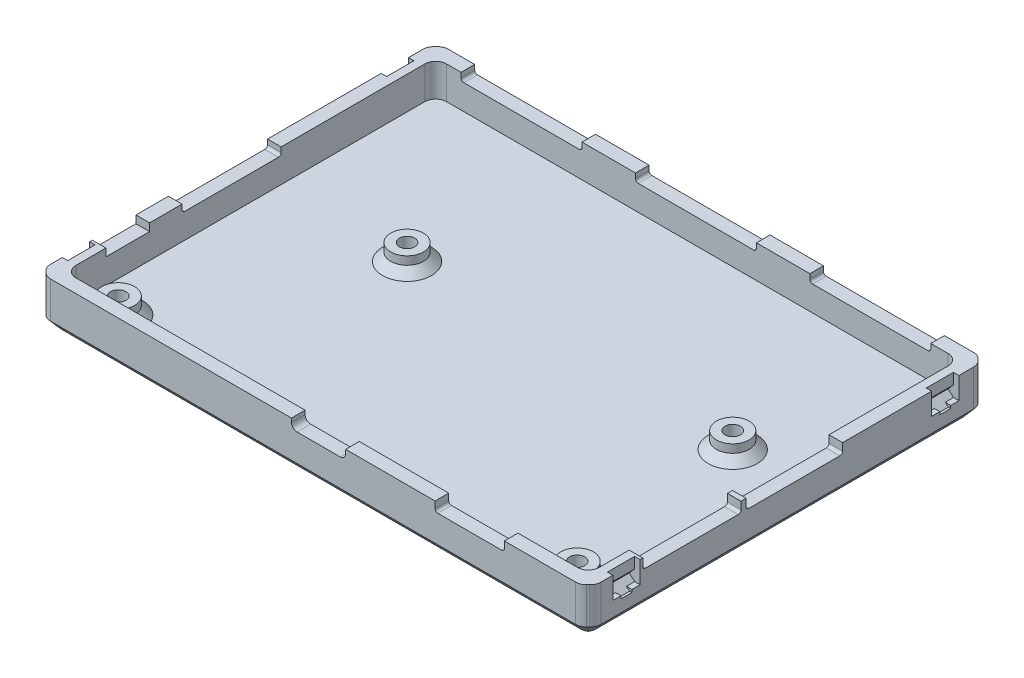
from build123d import *

# Parameters (mm, degrees)
SKETCH1_W           = 101
SKETCH1_H           = 73
BOSS_EXTRUDE1_DEPTH = 8.5
SHELL1_T            = -2.5
SKETCH5_W           = 9.94
SKETCH5_H           = 1.7
CUT_EXTRUDE1_DEPTH  = 10
SKETCH6_W           = 12.7
SKETCH6_H           = 1.71
CUT_EXTRUDE2_DEPTH  = 10
SKETCH7_W           = 18.026547022
SKETCH7_H           = 1.85
SKETCH7_W_2         = 17.7
CUT_EXTRUDE3_DEPTH  = 10
SKETCH8_W           = 22.18
SKETCH8_H           = 1.4
CUT_EXTRUDE4_DEPTH  = 10
SKETCH9_W           = 18.18
SKETCH9_H           = 1.4
CUT_EXTRUDE5_DEPTH  = 10
SKETCH10_W          = 8
SKETCH10_H          = 1.4
CUT_EXTRUDE6_DEPTH  = 10
FILLET1_R           = 2
SKETCH11_R          = 3
BOSS_EXTRUDE3_DEPTH = 3
SKETCH12_R          = 1.4
BOSS_EXTRUDE4_DEPTH = 3
CHAMFER1_SIZE       = 1.5
CHAMFER2_SIZE       = 1.5
CHAMFER3_SIZE       = 1.5
CHAMFER3_SIZE2      = 1.787630389
FILLET3_R           = 2
FILLET4_R           = 2.6
SKETCH14_R          = 1.4
CUT_EXTRUDE7_DEPTH  = 3
FILLET5_R           = 1
FILLET6_R           = 0.5
FILLET7_R           = 0.5
CUT_EXTRUDE8_DEPTH  = 5
SKETCH17_W          = 1
SKETCH17_H          = 4
CUT_EXTRUDE9_DEPTH  = 5
CUT_EXTRUDE10_REACH = 109.729
SKETCH18_W          = 2
SKETCH18_H          = 0.5
CUT_EXTRUDE11_REACH = 109.729
SKETCH19_W          = 2
SKETCH19_H          = 0.5


with BuildPart() as part:
    # Sketch1 → Boss-Extrude1 (new body)
    with BuildSketch(Plane(origin=(0, 0, 0), x_dir=(1, 0, 0), z_dir=(0, 1, 0))):
        Rectangle(SKETCH1_W, SKETCH1_H)
    extrude(amount=BOSS_EXTRUDE1_DEPTH)

    # Shell1
    shell1_openings = [part.faces().sort_by_distance(p)[0] for p in [
        (0, 8.5, 0),
    ]]
    offset(amount=SHELL1_T, openings=shell1_openings, kind=Kind.INTERSECTION)

    # Sketch5 → Cut-Extrude1 (cut)
    with BuildSketch(Plane.XY.offset(36.5)):
        with Locations((1.01, 7.65)):
            Rectangle(SKETCH5_W, SKETCH5_H)
    extrude(amount=-CUT_EXTRUDE1_DEPTH, mode=Mode.SUBTRACT)

    # Sketch6 → Cut-Extrude2 (cut)
    with BuildSketch(Plane.XY.offset(36.5)):
        with Locations((28.744046951, 7.645)):
            Rectangle(SKETCH6_W, SKETCH6_H)
    extrude(amount=-CUT_EXTRUDE2_DEPTH, mode=Mode.SUBTRACT)

    # Sketch7 → Cut-Extrude3 (cut)
    with BuildSketch(Plane(origin=(50.5, 0, 0), x_dir=(0, 0, -1), z_dir=(1, 0, 0))):
        with Locations((-17.486726489, 7.575)):
            Rectangle(SKETCH7_W, SKETCH7_H)
        with Locations((1.314047022, 7.575)):
            Rectangle(SKETCH7_W_2, SKETCH7_H)
    extrude(amount=-CUT_EXTRUDE3_DEPTH, mode=Mode.SUBTRACT)

    # Sketch8 → Cut-Extrude4 (cut)
    with BuildSketch(Plane(origin=(0, 0, -36.5), x_dir=(-1, 0, 0), z_dir=(0, 0, -1))):
        with Locations((-31.75, 7.8)):
            Rectangle(SKETCH8_W, SKETCH8_H)
        with Locations((0.25, 7.8)):
            Rectangle(SKETCH8_W, SKETCH8_H)
        with Locations((32.25, 7.8)):
            Rectangle(SKETCH8_W, SKETCH8_H)
    extrude(amount=-CUT_EXTRUDE4_DEPTH, mode=Mode.SUBTRACT)

    # Sketch9 → Cut-Extrude5 (cut)
    with BuildSketch(Plane.ZY.offset(50.5)):
        with Locations((3.45, 7.8)):
            Rectangle(SKETCH9_W, SKETCH9_H)
    extrude(amount=-CUT_EXTRUDE5_DEPTH, mode=Mode.SUBTRACT)

    # Sketch10 → Cut-Extrude6 (cut)
    with BuildSketch(Plane.ZY.offset(50.5)):
        with Locations((22.5, 7.8)):
            Rectangle(SKETCH10_W, SKETCH10_H)
    extrude(amount=-CUT_EXTRUDE6_DEPTH, mode=Mode.SUBTRACT)

    # Fillet1
    fillet1_edges = [part.edges().sort_by_distance(p)[0] for p in [
        (48, 5.5, 34),
        (48, 5.5, -34),
        (-48, 5.5, -34),
        (-48, 5.5, 34),
    ]]
    fillet(fillet1_edges, radius=FILLET1_R)

    # Sketch11 → Boss-Extrude3 (add)
    with BuildSketch(Plane(origin=(0, 2.5, 0), x_dir=(1, 0, 0), z_dir=(0, 1, 0))):
        with Locations(Location((35.5, 5, 0), (0, 0, 90))):
            Circle(SKETCH11_R)
        with Locations(Location((42, -30.05, 0), (0, 0, 90))):
            Circle(SKETCH11_R)
        with Locations(Location((-42.25, -30, 0), (0, 0, 90))):
            Circle(SKETCH11_R)
        with Locations(Location((-24.25, 5, 0), (0, 0, 90))):
            Circle(SKETCH11_R)
    extrude(amount=BOSS_EXTRUDE3_DEPTH)

    # Sketch12 → Boss-Extrude4 (add)
    with BuildSketch(Plane(origin=(0, 5.5, 0), x_dir=(1, 0, 0), z_dir=(0, 1, 0))):
        with Locations((-42.25, -30)):
            Circle(SKETCH12_R)
        with Locations((-24.25, 5)):
            Circle(SKETCH12_R)
        with Locations((35.5, 5)):
            Circle(SKETCH12_R)
        with Locations((42, -30.05)):
            Circle(SKETCH12_R)
    extrude(amount=-BOSS_EXTRUDE4_DEPTH)

    # Chamfer1
    # the kernel refuses this chamfer: 1.5 mm, written as the material it adds along each edge
    with BuildSketch(Plane(origin=(35.5, 2.5, -5), x_dir=(0, 0, -1), z_dir=(1, 0, 0))) as chamfer1_piece_1:
        Polygon((3 + CHAMFER1_SIZE, 0), (3, CHAMFER1_SIZE), (3, 0), align=None)
    revolve(axis=Axis((35.5, 2.5, -5), (0, 1, 0)))
    with BuildSketch(Plane(origin=(42, 2.5, 30.05), x_dir=(0, 0, -1), z_dir=(1, 0, 0))) as chamfer1_piece_2:
        Polygon((3 + CHAMFER1_SIZE, 0), (3, CHAMFER1_SIZE), (3, 0), align=None)
    revolve(axis=Axis((42, 2.5, 30.05), (0, 1, 0)))
    with BuildSketch(Plane(origin=(-42.25, 2.5, 30), x_dir=(0, 0, -1), z_dir=(1, 0, 0))) as chamfer1_piece_3:
        Polygon((3 + CHAMFER1_SIZE, 0), (3, CHAMFER1_SIZE), (3, 0), align=None)
    revolve(axis=Axis((-42.25, 2.5, 30), (0, 1, 0)))
    with BuildSketch(Plane(origin=(-24.25, 2.5, -5), x_dir=(0, 0, -1), z_dir=(1, 0, 0))) as chamfer1_piece_4:
        Polygon((3 + CHAMFER1_SIZE, 0), (3, CHAMFER1_SIZE), (3, 0), align=None)
    revolve(axis=Axis((-24.25, 2.5, -5), (0, 1, 0)))

    # Chamfer2
    chamfer2_edges = [part.edges().sort_by_distance(p)[0] for p in [
        (50.5, 4.25, 36.5),
        (-50.5, 4.25, 36.5),
        (-50.5, 4.25, -36.5),
        (50.5, 4.25, -36.5),
    ]]
    chamfer(chamfer2_edges, length=CHAMFER2_SIZE)

    # Chamfer3
    chamfer3_edges = [part.edges().sort_by_distance(p)[0] for p in [
        (-50.5, 0, 0),
        (50.5, 0, 0),
        (0, 0, 36.5),
        (0, 0, -36.5),
        (-49.75, 0, 35.75),
        (49.75, 0, 35.75),
        (49.75, 0, -35.75),
        (-49.75, 0, -35.75),
    ]]
    chamfer3_side = [part.faces().sort_by_distance(p)[0] for p in [
        (0, 0, 0),
    ]]
    chamfer(chamfer3_edges, length=CHAMFER3_SIZE, length2=CHAMFER3_SIZE2, reference=chamfer3_side[0])

    # Fillet3
    fillet3_edges = [part.edges().sort_by_distance(p)[0] for p in [
        (-50.5, 5.143815194, -35),
        (49, 5.143815194, -36.5),
        (50.5, 5.143815194, 35),
        (-49, 5.143815194, 36.5),
        (-50.5, 5.143815194, 35),
        (49, 5.143815194, 36.5),
        (50.5, 5.143815194, -35),
        (-49, 5.143815194, -36.5),
    ]]
    fillet(fillet3_edges, radius=FILLET3_R)

    # Fillet4
    # the kernel refuses this fillet: 2.6 mm, written as the material it takes off along each edge
    with BuildSketch(Plane(origin=(47.762017912, -1.475369601, 33.865890686), x_dir=(0.1653814980064889, 0.19709399439784892, -0.9663347854079508), z_dir=(0.6211480268693303, 0.740255392554332, 0.25728793697056535)), Plane(origin=(47.762017912, -1.475369601, -33.865890686), x_dir=(-0.5663595009352346, 0.19709399439784991, -0.8002442583815846), z_dir=(0.6211480268693303, 0.740255392554332, -0.25728793697056535)), Plane(origin=(47.865890686, -1.475369601, -33.762017912), x_dir=(-0.9663347854079508, 0.19709399439784592, -0.16538149800649246), z_dir=(0.25728793697056535, 0.740255392554332, -0.6211480268693303))) as fillet4_piece_1:
        with BuildLine():
            CenterArc((FILLET4_R * 0.306623823216, FILLET4_R), FILLET4_R, 235.906425585, 34.093574415)
            Line((-FILLET4_R * 0.253922302826, FILLET4_R * 0.171876796256), (0, 0))
            Line((0, 0), (FILLET4_R * 0.306623823216, 0))
        make_face()
    extrude(amount=6.155896945, mode=Mode.SUBTRACT)
    with BuildSketch(Plane(origin=(47.865890686, -1.475369601, 33.762017912), x_dir=(-0.9663347854079509, 0.19709399439784686, 0.1653814980064914), z_dir=(0.25728793697056535, 0.740255392554332, 0.6211480268693303)), Plane(origin=(-47.865890686, -1.475369601, 33.762017912), x_dir=(-0.8002442583815882, 0.19709399439784556, -0.566359500935231), z_dir=(-0.25728793697056535, 0.740255392554332, 0.6211480268693303)), Plane(origin=(-47.762017912, -1.475369601, 33.865890686), x_dir=(-0.16538149800648946, 0.19709399439784844, -0.9663347854079508), z_dir=(-0.6211480268693303, 0.740255392554332, 0.25728793697056535)), Plane(origin=(-47.865890686, -1.475369601, -33.762017912), x_dir=(0.9663347854079508, 0.19709399439784658, -0.16538149800649166), z_dir=(-0.25728793697056535, 0.740255392554332, -0.6211480268693303)), Plane(origin=(-47.762017912, -1.475369601, -33.865890686), x_dir=(0.5663595009352324, 0.19709399439784725, -0.8002442583815867), z_dir=(-0.6211480268693303, 0.740255392554332, -0.25728793697056535))) as fillet4_piece_2:
        with BuildLine():
            CenterArc((FILLET4_R * 0.306623823216, -FILLET4_R), FILLET4_R, 90, 34.093574415)
            Line((-FILLET4_R * 0.253922302826, -FILLET4_R * 0.171876796256), (0, 0))
            Line((0, 0), (FILLET4_R * 0.306623823216, 0))
        make_face()
    extrude(amount=6.155896945, mode=Mode.SUBTRACT)

    # Sketch14 → Cut-Extrude7 (cut)
    with BuildSketch(Plane(origin=(0, 5.5, 0), x_dir=(1, 0, 0), z_dir=(0, 1, 0))):
        with Locations(Location((-24.25, 5, 0), (0, 0, 270))):
            Circle(SKETCH14_R)
        with Locations(Location((-42.25, -30, 0), (0, 0, 270))):
            Circle(SKETCH14_R)
        with Locations(Location((35.5, 5, 0), (0, 0, 270))):
            Circle(SKETCH14_R)
        with Locations(Location((42, -30.05, 0), (0, 0, 270))):
            Circle(SKETCH14_R)
    extrude(amount=-CUT_EXTRUDE7_DEPTH, mode=Mode.SUBTRACT)

    # Fillet5
    fillet5_edges = [part.edges().sort_by_distance(p)[0] for p in [
        (-3.96, 6.8, 35.25),
        (5.98, 6.8, 35.25),
    ]]
    fillet(fillet5_edges, radius=FILLET5_R)

    # Fillet6
    fillet6_edges = [part.edges().sort_by_distance(p)[0] for p in [
        (22.394046951, 6.79, 35.25),
        (35.094046951, 6.79, 35.25),
    ]]
    fillet(fillet6_edges, radius=FILLET6_R)

    # Fillet7
    fillet7_edges = [part.edges().sort_by_distance(p)[0] for p in [
        (42.84, 7.1, -35.25),
        (20.66, 7.1, -35.25),
        (10.84, 7.1, -35.25),
        (-11.34, 7.1, -35.25),
        (-21.16, 7.1, -35.25),
        (-43.34, 7.1, -35.25),
        (-49.25, 7.1, -5.64),
        (-49.25, 7.1, 12.54),
        (49.25, 6.65, 26.5),
        (49.25, 6.65, 8.473452978),
        (49.25, 6.65, 7.535952978),
        (49.25, 6.65, -10.164047022),
    ]]
    fillet(fillet7_edges, radius=FILLET7_R)

    # Sketch16 → Cut-Extrude8 (cut)
    with BuildSketch(Plane.XY.offset(-31.5)):
        Polygon((48.507835839, 5.375006544), (49.5, 6.5), (49.5, 4.5), align=None)
        Polygon((49.5, 8.5), (49.5, 6.5), (49.5, 4.5), (50.5, 4.5), (50.5, 8.5), align=None)
        Polygon((-49.5, 4.5), (-49.5, 6.5), (-48.507843258, 5.375), align=None)
        Polygon((-49.5, 4.5), (-49.5, 6.5), (-49.5, 8.5), (-50.5, 8.5), (-50.5, 4.5), align=None)
    extrude(amount=CUT_EXTRUDE8_DEPTH, mode=Mode.SUBTRACT)

    # Sketch17 → Cut-Extrude9 (cut)
    with BuildSketch(Plane(origin=(0, 0, 32), x_dir=(-1, 0, 0), z_dir=(0, 0, -1))):
        with Locations((50, 6.5)):
            Rectangle(SKETCH17_W, SKETCH17_H)
        Polygon((49.5, 4.5), (49.5, 6.5), (48.507835839, 5.375006544), align=None)
        with Locations((-50, 6.5)):
            Rectangle(SKETCH17_W, SKETCH17_H)
        Polygon((-48.507835839, 5.375006544), (-49.5, 6.5), (-49.5, 4.5), align=None)
    extrude(amount=CUT_EXTRUDE9_DEPTH, mode=Mode.SUBTRACT)

    # Cut-Extrude10: up to this plane
    cut_extrude10_end = Plane(origin=(-23.888602669, 27.087129356, -26.5), z_dir=(0.6614378277661467, -0.7500000000000009, 0))
    # Sketch18 → Cut-Extrude10 (cut, up to the surface)
    with BuildSketch(Plane.ZY.offset(50.5), mode=Mode.PRIVATE) as cut_extrude10_sk1:
        with Locations((-29, 4.25)):
            Rectangle(SKETCH18_W, SKETCH18_H)
    cut_extrude10_tool1 = split(extrude(cut_extrude10_sk1.sketch, amount=-CUT_EXTRUDE10_REACH, mode=Mode.PRIVATE), bisect_by=cut_extrude10_end, keep=Keep.BOTH, mode=Mode.PRIVATE)
    add(cut_extrude10_tool1.solids().sort_by_distance((-50.5, 4.25, -29))[0], mode=Mode.SUBTRACT)
    # Sketch18 → Cut-Extrude10 (cut, up to the surface)
    with BuildSketch(Plane.ZY.offset(50.5), mode=Mode.PRIVATE) as cut_extrude10_sk2:
        with Locations((29.5, 4.25)):
            Rectangle(SKETCH18_W, SKETCH18_H)
    cut_extrude10_tool2 = split(extrude(cut_extrude10_sk2.sketch, amount=-CUT_EXTRUDE10_REACH, mode=Mode.PRIVATE), bisect_by=cut_extrude10_end, keep=Keep.BOTH, mode=Mode.PRIVATE)
    add(cut_extrude10_tool2.solids().sort_by_distance((-50.5, 4.25, 29.5))[0], mode=Mode.SUBTRACT)

    # Cut-Extrude11: up to this plane
    cut_extrude11_end = Plane(origin=(23.88860267, 27.087129356, -26.5), z_dir=(-0.6614378277846439, -0.7499999999836879, 0))
    # Sketch19 → Cut-Extrude11 (cut, up to the surface)
    with BuildSketch(Plane(origin=(50.5, 0, 0), x_dir=(0, 0, -1), z_dir=(1, 0, 0)), mode=Mode.PRIVATE) as cut_extrude11_sk1:
        with Locations((-29.5, 4.25)):
            Rectangle(SKETCH19_W, SKETCH19_H)
    cut_extrude11_tool1 = split(extrude(cut_extrude11_sk1.sketch, amount=-CUT_EXTRUDE11_REACH, mode=Mode.PRIVATE), bisect_by=cut_extrude11_end, keep=Keep.BOTH, mode=Mode.PRIVATE)
    add(cut_extrude11_tool1.solids().sort_by_distance((50.5, 4.25, 29.5))[0], mode=Mode.SUBTRACT)
    # Sketch19 → Cut-Extrude11 (cut, up to the surface)
    with BuildSketch(Plane(origin=(50.5, 0, 0), x_dir=(0, 0, -1), z_dir=(1, 0, 0)), mode=Mode.PRIVATE) as cut_extrude11_sk2:
        with Locations((29, 4.25)):
            Rectangle(SKETCH19_W, SKETCH19_H)
    cut_extrude11_tool2 = split(extrude(cut_extrude11_sk2.sketch, amount=-CUT_EXTRUDE11_REACH, mode=Mode.PRIVATE), bisect_by=cut_extrude11_end, keep=Keep.BOTH, mode=Mode.PRIVATE)
    add(cut_extrude11_tool2.solids().sort_by_distance((50.5, 4.25, -29))[0], mode=Mode.SUBTRACT)


solid = part.part
